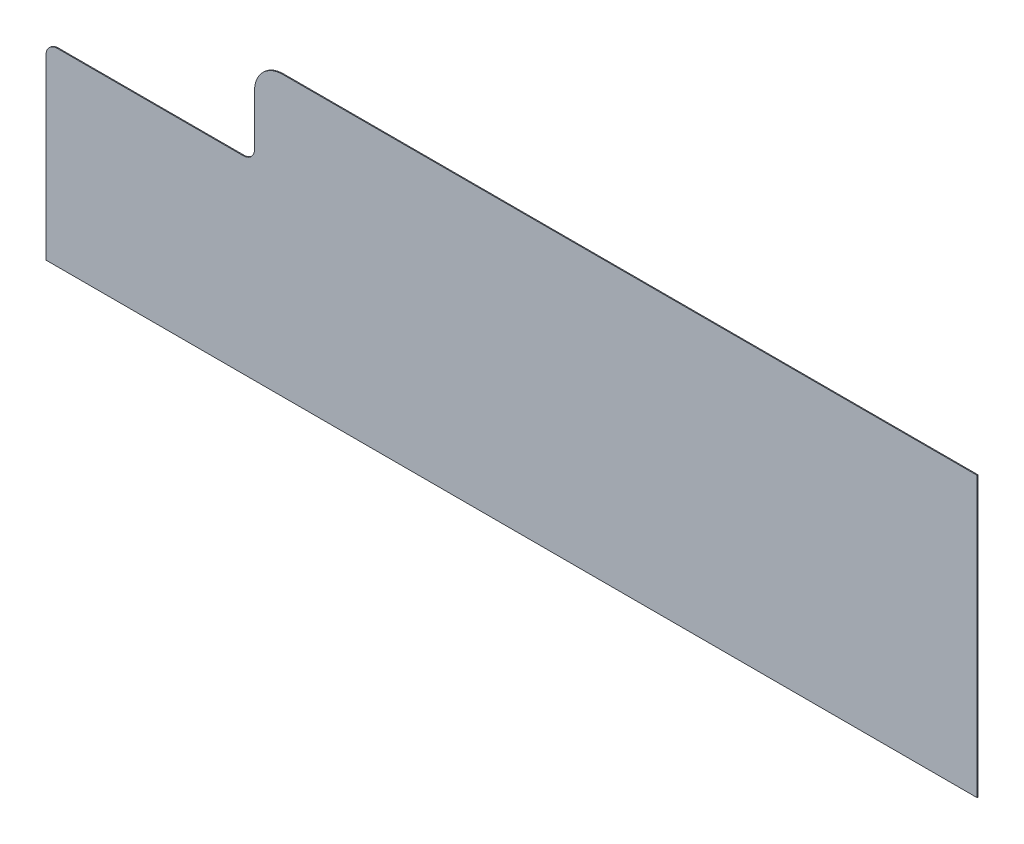
from build123d import *

# Parameters (mm, degrees)
CROQUIS1_W            = 1652
CROQUIS1_H            = 495.4
BRIDA_BASE1_DEPTH     = 1.5875
CROQUIS21_W           = 370
CROQUIS21_H           = 160
CORTAR_EXTRUIR2_DEPTH = 10
REDONDEO4_R           = 20
REDONDEO5_R           = 50
REDONDEO6_R           = 20


# Sheet-metal steps are written as plain solids
with BuildPart() as part:
    # Croquis1 → Brida base1 (new body)
    with BuildSketch(Plane.XY):
        with Locations((-270.54091127, -44.567814371)):
            Rectangle(CROQUIS1_W, CROQUIS1_H)
    extrude(amount=-BRIDA_BASE1_DEPTH)

    # Croquis21 → Cortar-Extruir2 (cut)
    with BuildSketch(Plane.XY):
        with Locations((-911.54091127, 123.132185629)):
            Rectangle(CROQUIS21_W, CROQUIS21_H)
    extrude(amount=-CORTAR_EXTRUIR2_DEPTH, mode=Mode.SUBTRACT)

    # Redondeo4
    redondeo4_edges = [part.edges().sort_by_distance(p)[0] for p in [
        (-726.54091127, 43.132185629, -0.79375),
    ]]
    fillet(redondeo4_edges, radius=REDONDEO4_R)

    # Redondeo5
    redondeo5_edges = [part.edges().sort_by_distance(p)[0] for p in [
        (-726.54091127, 203.132185629, -0.79375),
    ]]
    fillet(redondeo5_edges, radius=REDONDEO5_R)

    # Redondeo6
    redondeo6_edges = [part.edges().sort_by_distance(p)[0] for p in [
        (-1096.54091127, 43.132185629, -0.79375),
    ]]
    fillet(redondeo6_edges, radius=REDONDEO6_R)


solid = part.part
